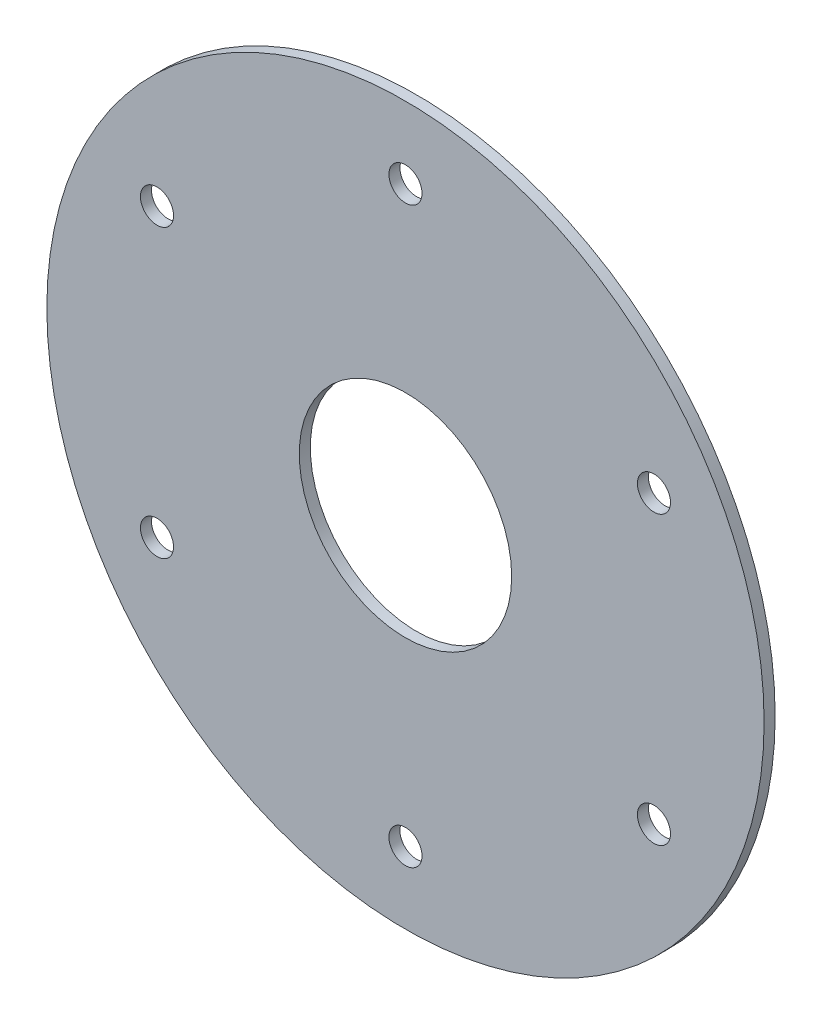
from build123d import *

# Parameters (mm, degrees)
SKETCH_1_R             = 130
SKETCH_1_R_2           = 38.5
SKETCH_1_R_3           = 6
SM_BASE_FLANGE_1_DEPTH = 4


# Sheet-metal steps are written as plain solids
with BuildPart() as part:
    # Sketch 1 → Базовая кромка1 (new body)
    with BuildSketch(Plane.XY):
        Circle(SKETCH_1_R)
        Circle(SKETCH_1_R_2, mode=Mode.SUBTRACT)
        with Locations((0, 104)):
            Circle(SKETCH_1_R_3, mode=Mode.SUBTRACT)
        with Locations((90.066641994, 52)):
            Circle(SKETCH_1_R_3, mode=Mode.SUBTRACT)
        with Locations((90.066641994, -52)):
            Circle(SKETCH_1_R_3, mode=Mode.SUBTRACT)
        with Locations((0, -104)):
            Circle(SKETCH_1_R_3, mode=Mode.SUBTRACT)
        with Locations((-90.066641994, -52)):
            Circle(SKETCH_1_R_3, mode=Mode.SUBTRACT)
        with Locations((-90.066641994, 52)):
            Circle(SKETCH_1_R_3, mode=Mode.SUBTRACT)
    extrude(amount=SM_BASE_FLANGE_1_DEPTH)


solid = part.part
